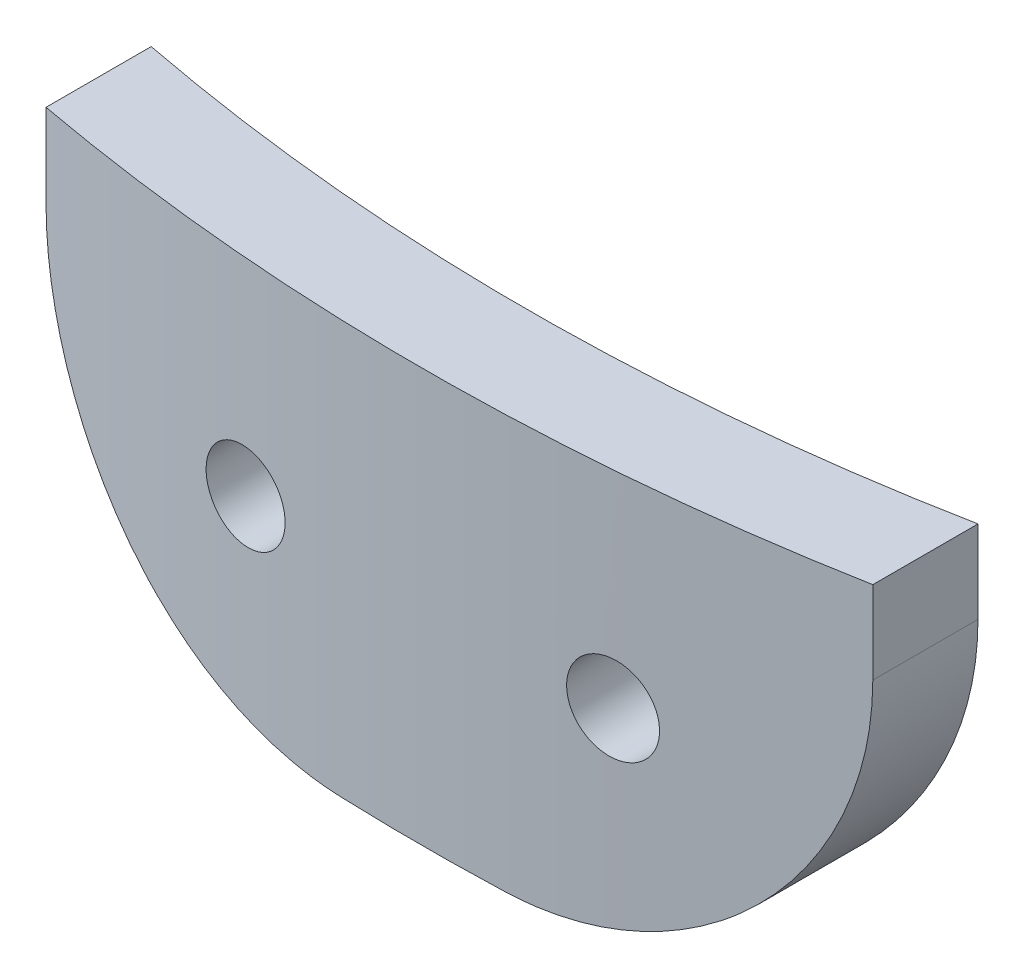
from build123d import *

# Parameters (mm, degrees)
BOSS_EXTRUDE1_DEPTH     = 12.7
CUT_EXTRUDE1_REACH      = 74.122
CUT_EXTRUDE1_END_RADIUS = 69.85
SKETCH2_R               = 1.3208
CUT_EXTRUDE2_REACH      = 74.122
CUT_EXTRUDE2_END_RADIUS = 69.85


with BuildPart() as part:
    # Sketch1 → Boss-Extrude1 (new body)
    with BuildSketch(Plane(origin=(0, 0, 0), x_dir=(1, 0, 0), z_dir=(0, 1, 0))):
        with BuildLine():
            ThreePointArc((12.7, -65.454301807), (0, -66.675), (-12.7, -65.454301807))
            Line((-12.7, -65.454301807), (-12.7, -68.685751798))
            ThreePointArc((-12.7, -68.685751798), (0, -69.85), (12.7, -68.685751798))
            Line((12.7, -68.685751798), (12.7, -65.454301807))
        make_face()
    extrude(amount=BOSS_EXTRUDE1_DEPTH)

    # Cut-Extrude1: up to this cylinder (the profile starts inside it)
    cut_extrude1_end = Plane(origin=(0, 6.35, 0), z_dir=(0, -1, 0)) * Cylinder(CUT_EXTRUDE1_END_RADIUS, 288.944, mode=Mode.PRIVATE)
    # Sketch2 → Cut-Extrude1 (cut, up to the surface)
    with BuildSketch(Plane.XY, mode=Mode.PRIVATE) as cut_extrude1_sk1:
        with Locations((-5.644444444, 6.35)):
            Circle(SKETCH2_R)
    cut_extrude1_tool1 = extrude(cut_extrude1_sk1.sketch, amount=CUT_EXTRUDE1_REACH, mode=Mode.PRIVATE) & cut_extrude1_end
    cut_extrude1 = cut_extrude1_tool1.solids().sort_by_distance((-5.644444, 6.35, 0))[0]
    add(cut_extrude1, mode=Mode.SUBTRACT)

    # Mirror1: Cut-Extrude1 across plane
    add(cut_extrude1.mirror(Plane(origin=(0, 0, 0), x_dir=(0, 0, 1), z_dir=(1, 0, 0))), mode=Mode.SUBTRACT)

    # Cut-Extrude2: up to this cylinder (the profile starts inside it)
    cut_extrude2_end = Plane(origin=(0, 2.269418, 0), z_dir=(0, -1, 0)) * Cylinder(CUT_EXTRUDE2_END_RADIUS, 288.944, mode=Mode.PRIVATE)
    # Sketch3 → Cut-Extrude2 (cut, up to the surface)
    with BuildSketch(Plane.XY, mode=Mode.PRIVATE) as cut_extrude2_sk1:
        with BuildLine():
            ThreePointArc((-2.54, 0), (-9.724204897, 2.975795103), (-12.7, 10.16))
            Line((-12.7, 10.16), (-12.7, 0))
            Line((-12.7, 0), (-2.54, 0))
        make_face()
    cut_extrude2_tool1 = extrude(cut_extrude2_sk1.sketch, amount=CUT_EXTRUDE2_REACH, mode=Mode.PRIVATE) & cut_extrude2_end
    add(cut_extrude2_tool1.solids().sort_by_distance((-10.430582, 2.269418, 0))[0], mode=Mode.SUBTRACT)
    # Sketch3 → Cut-Extrude2 (cut, up to the surface)
    with BuildSketch(Plane.XY, mode=Mode.PRIVATE) as cut_extrude2_sk2:
        with BuildLine():
            Line((12.7, 0), (12.7, 10.16))
            ThreePointArc((12.7, 10.16), (9.724204897, 2.975795103), (2.54, 0))
            Line((2.54, 0), (12.7, 0))
        make_face()
    cut_extrude2_tool2 = extrude(cut_extrude2_sk2.sketch, amount=CUT_EXTRUDE2_REACH, mode=Mode.PRIVATE) & cut_extrude2_end
    add(cut_extrude2_tool2.solids().sort_by_distance((10.430582, 2.269418, 0))[0], mode=Mode.SUBTRACT)


solid = part.part
